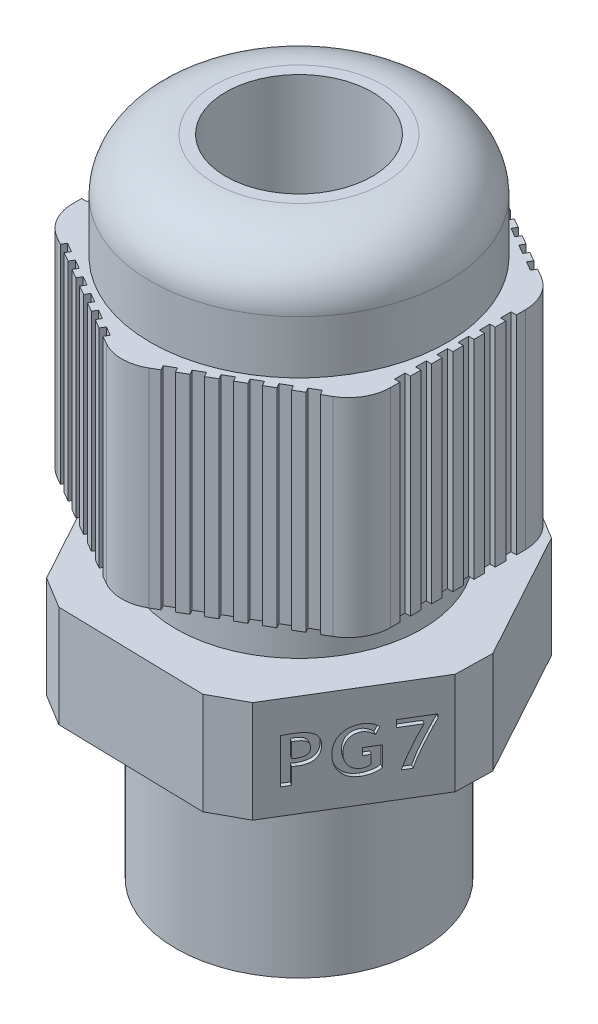
from build123d import *

# Parameters (mm, degrees)
SKETCH1_R           = 5.8
BOSS_EXTRUDE1_DEPTH = 8.25
BOSS_EXTRUDE2_DEPTH = 4.8
SKETCH3_R           = 5.8
BOSS_EXTRUDE3_DEPTH = 2.5
BOSS_EXTRUDE4_DEPTH = 9.8
CHAMFER1_SIZE       = 1
FILLET1_R           = 2
SKETCH5_R           = 7
BOSS_EXTRUDE5_DEPTH = 5
FILLET2_SIZE        = 2.5
FILLET2_SIZE_2      = 3
SKETCH6_R           = 3.45
CUT_EXTRUDE1_DEPTH  = 30.35
CUT_EXTRUDE2_DEPTH  = 0.2
SKETCH8_W           = 0.5
SKETCH8_H           = 9.8
CUT_EXTRUDE3_DEPTH  = 0.25
CIRPATTERN1_COUNT   = 6
CIRPATTERN2_COUNT   = 3


with BuildPart() as part:
    # Sketch1 → Boss-Extrude1 (new body)
    with BuildSketch(Plane(origin=(0, 0, 0), x_dir=(1, 0, 0), z_dir=(0, 1, 0))):
        with Locations(Location((0, 0, 0), (0, 0, 270))):
            Circle(SKETCH1_R)
    extrude(amount=BOSS_EXTRUDE1_DEPTH)

    # Sketch2 → Boss-Extrude2 (add)
    with BuildSketch(Plane(origin=(0, 8.25, 0), x_dir=(1, 0, 0), z_dir=(0, 1, 0))):
        Polygon((8.946496097, -0.208664632), (4.65395692, 7.643560578), (-4.292539176, 7.85222521), (-8.946496097, 0.208664632), (-4.65395692, -7.643560578), (4.292539176, -7.85222521), align=None)
    extrude(amount=BOSS_EXTRUDE2_DEPTH)

    # Sketch3 → Boss-Extrude3 (add)
    with BuildSketch(Plane(origin=(0, 13.05, 0), x_dir=(1, 0, 0), z_dir=(0, 1, 0))):
        with Locations(Location((0, 0, 0), (0, 0, 270))):
            Circle(SKETCH3_R)
    extrude(amount=BOSS_EXTRUDE3_DEPTH)

    # Sketch4 → Boss-Extrude4 (add)
    with BuildSketch(Plane(origin=(0, 15.55, 0), x_dir=(1, 0, 0), z_dir=(0, 1, 0))):
        Polygon((7.5, 4.330127019), (0, 8.660254038), (-7.5, 4.330127019), (-7.5, -4.330127019), (0, -8.660254038), (7.5, -4.330127019), align=None)
    extrude(amount=BOSS_EXTRUDE4_DEPTH)

    # Chamfer1
    chamfer1_edges = [part.edges().sort_by_distance(p)[0] for p in [
        (4.292539176, 10.65, 7.85222521),
        (8.946496097, 10.65, 0.208664632),
        (4.65395692, 10.65, -7.643560578),
        (-4.292539176, 10.65, -7.85222521),
        (-8.946496097, 10.65, -0.208664632),
        (-4.65395692, 10.65, 7.643560578),
    ]]
    chamfer(chamfer1_edges, length=CHAMFER1_SIZE)

    # Fillet1
    fillet1_edges = [part.edges().sort_by_distance(p)[0] for p in [
        (7.5, 20.45, 4.330127019),
        (7.5, 20.45, -4.330127019),
        (0, 20.45, -8.660254038),
        (-7.5, 20.45, -4.330127019),
        (-7.5, 20.45, 4.330127019),
        (0, 20.45, 8.660254038),
    ]]
    fillet(fillet1_edges, radius=FILLET1_R)

    # Sketch5 → Boss-Extrude5 (add)
    with BuildSketch(Plane(origin=(0, 25.35, 0), x_dir=(1, 0, 0), z_dir=(0, 1, 0))):
        with Locations(Location((0, 0, 0), (0, 0, 270))):
            Circle(SKETCH5_R)
    extrude(amount=BOSS_EXTRUDE5_DEPTH)

    # Fillet2
    # a fillet whose section is not a circle: 3, 2.5 mm, written as the material it takes off along each edge
    with BuildSketch(Plane(origin=(0, 30.35, 0), x_dir=(0, 0, 1), z_dir=(-1, 0, 0))) as fillet2_piece_1:
        with BuildLine():
            Bezier((7, -FILLET2_SIZE), (7, 0), (7 - FILLET2_SIZE_2, 0), weights=[1, 0.707106781, 1])
            Line((7 - FILLET2_SIZE_2, 0), (7, 0))
            Line((7, 0), (7, -FILLET2_SIZE))
        make_face()
    revolve(axis=Axis((0, 30.35, 0), (0, 1, 0)), mode=Mode.SUBTRACT)

    # Sketch6 → Cut-Extrude1 (cut)
    with BuildSketch(Plane(origin=(0, 30.35, 0), x_dir=(1, 0, 0), z_dir=(0, 1, 0))):
        with Locations(Location((0, 0, 0), (0, 0, 270))):
            Circle(SKETCH6_R)
    extrude(amount=-CUT_EXTRUDE1_DEPTH, mode=Mode.SUBTRACT)

    # Sketch7 → Cut-Extrude2 (cut)
    # profile 1 of 3: a face of its own
    with BuildSketch(Plane(origin=(-6.800226508, 0, 3.717447973), x_dir=(0.4796707062222577, 0, 0.8774485817369816), z_dir=(-0.8774485817369816, 0, 0.4796707062222577))):
        with BuildLine():
            Line((-2.134885405, 10.216379947), (-2.134885405, 9.45))
            Line((-2.134885405, 9.45), (-2.513219528, 9.45))
            Line((-2.513219528, 9.45), (-2.513219528, 11.542238367))
            add(Edge.make_bspline(
                [(-2.513219528, 11.542238367), (-2.483523913, 11.543567356), (-2.427375364, 11.546080213), (-2.347967637, 11.548688603), (-2.27846118, 11.551957657), (-2.218632578, 11.553974035), (-2.168665192, 11.555578539), (-2.128279385, 11.557149828), (-2.097725351, 11.557314508), (-2.08055587, 11.55770478), (-2.073659459, 11.55786154)],
                knots=[0, 0, 0, 0, 1.621915894, 3.06672294, 4.33503342, 5.418568965, 6.332983946, 7.062930741, 7.623610357, 8, 8, 8, 8], degree=3))
            add(Edge.make_bspline(
                [(-2.073659459, 11.55786154), (-2.033253135, 11.557378437), (-1.95518837, 11.556445087), (-1.842316581, 11.549232733), (-1.737858336, 11.537617628), (-1.641731769, 11.521448641), (-1.553863318, 11.500074815), (-1.474521723, 11.473564124), (-1.403211823, 11.442992506), (-1.340418447, 11.406840154), (-1.285417521, 11.365570046), (-1.237401277, 11.319382527), (-1.197617084, 11.26710511), (-1.163991949, 11.210101824), (-1.138970637, 11.147036902), (-1.12063961, 11.078922791), (-1.110248523, 11.005456847), (-1.108749639, 10.954782697), (-1.107978502, 10.928712162)],
                knots=[0, 0, 0, 0, 1.477239666, 2.854017795, 4.133233606, 5.318502461, 6.415589596, 7.435923392, 8.373832858, 9.247662204, 10.078235651, 10.882486382, 11.675045235, 12.472932273, 13.294755343, 14.147339862, 15.04685446, 16, 16, 16, 16], degree=3))
            add(Edge.make_bspline(
                [(-1.107978502, 10.928712162), (-1.108573533, 10.899542636), (-1.109730059, 10.842847635), (-1.120185701, 10.760787184), (-1.13618153, 10.684080634), (-1.160129653, 10.61328312), (-1.189904379, 10.547710765), (-1.227062562, 10.488065605), (-1.270707731, 10.4339653), (-1.321709039, 10.385985109), (-1.378896899, 10.343043645), (-1.443115023, 10.306352429), (-1.513823244, 10.275484008), (-1.591060478, 10.250283457), (-1.674939167, 10.230432462), (-1.765622391, 10.216886085), (-1.86293348, 10.208306115), (-1.930076108, 10.207225702), (-1.9647195, 10.206668245)],
                knots=[0, 0, 0, 0, 1.091067431, 2.120640177, 3.090684274, 4.018396006, 4.911555342, 5.779703764, 6.64093865, 7.505260178, 8.393264397, 9.311130961, 10.266246865, 11.27557445, 12.347403441, 13.487847833, 14.703811947, 16, 16, 16, 16], degree=3))
            add(Edge.make_bspline(
                [(-1.9647195, 10.206668245), (-1.976123556, 10.206701924), (-2.000920231, 10.206775155), (-2.040735846, 10.209336139), (-2.086082113, 10.21207232), (-2.118001293, 10.214889669), (-2.134885405, 10.216379947)],
                knots=[0, 0, 0, 0, 0.802473668, 1.744877334, 2.807120216, 4, 4, 4, 4], degree=3))
        make_face()
        with BuildLine():
            Line((-2.134885405, 11.226396934), (-2.134885405, 10.541088585))
            add(Edge.make_bspline(
                [(-2.134885405, 10.541088585), (-2.119684957, 10.539683417), (-2.091123571, 10.53704313), (-2.050769504, 10.53327857), (-2.015540106, 10.531766425), (-1.993714297, 10.531209597), (-1.983720656, 10.530954636)],
                knots=[0, 0, 0, 0, 1.208754047, 2.271228472, 3.208426916, 4, 4, 4, 4], degree=3))
            add(Edge.make_bspline(
                [(-1.983720656, 10.530954636), (-1.962880278, 10.531135836), (-1.922560705, 10.531486401), (-1.864374221, 10.535910165), (-1.810433828, 10.542296714), (-1.761048697, 10.552316235), (-1.715568643, 10.563521662), (-1.674842164, 10.578994779), (-1.638315092, 10.596684303), (-1.605589771, 10.616857511), (-1.577622667, 10.641052235), (-1.552489017, 10.66758982), (-1.53250897, 10.698541535), (-1.51519604, 10.732191227), (-1.50224623, 10.769609665), (-1.493254671, 10.810290418), (-1.486924704, 10.854201041), (-1.486521703, 10.884633205), (-1.486312624, 10.900421552)],
                knots=[0, 0, 0, 0, 1.403595211, 2.715515055, 3.929222961, 5.059826169, 6.108541088, 7.08069188, 7.988175292, 8.840483437, 9.661193659, 10.47314836, 11.293639464, 12.13324769, 13.017905562, 13.951754922, 14.937360934, 16, 16, 16, 16], degree=3))
            add(Edge.make_bspline(
                [(-1.486312624, 10.900421552), (-1.48667261, 10.913965119), (-1.487370582, 10.940224546), (-1.494066128, 10.978134579), (-1.503859402, 11.013686705), (-1.519019714, 11.04628161), (-1.537603358, 11.076815354), (-1.561032375, 11.104213439), (-1.588583551, 11.128943766), (-1.619855059, 11.151475598), (-1.655744825, 11.170803974), (-1.695521578, 11.187589522), (-1.739433227, 11.201996391), (-1.787421917, 11.213745397), (-1.83983467, 11.222321087), (-1.896158474, 11.229216183), (-1.956789048, 11.23286888), (-1.99849506, 11.23333462), (-2.020033975, 11.233575149)],
                knots=[0, 0, 0, 0, 0.913750955, 1.771658647, 2.592923553, 3.396899075, 4.190866566, 5.000218413, 5.821208234, 6.686404457, 7.596737657, 8.567773798, 9.598787233, 10.714604217, 11.900680618, 13.183445848, 14.545401084, 16, 16, 16, 16], degree=3))
            add(Edge.make_bspline(
                [(-2.020033975, 11.233575149), (-2.0394783, 11.233344616), (-2.077884026, 11.232889277), (-2.116044894, 11.228542831), (-2.134885405, 11.226396934)],
                knots=[0, 0, 0, 0, 1.012574262, 2, 2, 2, 2], degree=3))
        make_face(mode=Mode.SUBTRACT)
    # profile 2 of 3: a face of its own
    with BuildSketch(Plane(origin=(-6.800226508, 0, 3.717447973), x_dir=(0.4796707062222577, 0, 0.8774485817369816), z_dir=(-0.8774485817369816, 0, 0.4796707062222577))):
        with BuildLine():
            Line((0.891787574, 11.341670612), (0.736400346, 11.043563592))
            add(Edge.make_bspline(
                [(0.736400346, 11.043563592), (0.724076867, 11.054375595), (0.697509418, 11.077684544), (0.650376761, 11.109333555), (0.594070525, 11.140270196), (0.53178361, 11.170870113), (0.467487444, 11.198270759), (0.405340879, 11.218223881), (0.348040675, 11.23111622), (0.311253795, 11.232786508), (0.293884542, 11.233575149)],
                knots=[0, 0, 0, 0, 0.803088321, 1.731330006, 2.775510355, 3.951250131, 5.13276654, 6.197670446, 7.149014066, 8, 8, 8, 8], degree=3))
            add(Edge.make_bspline(
                [(0.293884542, 11.233575149), (0.268516955, 11.232929848), (0.218996656, 11.23167015), (0.146871851, 11.221756719), (0.078924726, 11.205833067), (0.014985708, 11.183361622), (-0.044924973, 11.154189176), (-0.100354598, 11.117950684), (-0.152063557, 11.075802101), (-0.1990169, 11.027314535), (-0.241340233, 10.973562986), (-0.278332239, 10.915067323), (-0.30893569, 10.851866097), (-0.334584632, 10.784528593), (-0.354272188, 10.712832218), (-0.368057371, 10.636664225), (-0.376661638, 10.556205217), (-0.377767163, 10.500997323), (-0.378334122, 10.472684425)],
                knots=[0, 0, 0, 0, 1.061607425, 2.072373566, 3.041316938, 3.978664007, 4.903577062, 5.82367322, 6.744825227, 7.690652244, 8.643063079, 9.60425442, 10.581865327, 11.577666068, 12.616882387, 13.689323984, 14.814989508, 16, 16, 16, 16], degree=3))
            add(Edge.make_bspline(
                [(-0.378334122, 10.472684425), (-0.377962667, 10.445773892), (-0.377239168, 10.393359162), (-0.368277431, 10.31690348), (-0.355159316, 10.244511191), (-0.33600237, 10.176132357), (-0.311761697, 10.111780412), (-0.281329353, 10.051903583), (-0.246408437, 9.995639321), (-0.205324345, 9.94434383), (-0.159961614, 9.897847329), (-0.110255241, 9.857421608), (-0.056507594, 9.82335115), (0.001011436, 9.795469319), (0.062633939, 9.773731709), (0.128022503, 9.758317236), (0.197469442, 9.748738382), (0.24501259, 9.747762822), (0.269394163, 9.747262525)],
                knots=[0, 0, 0, 0, 1.175642092, 2.289845553, 3.36012681, 4.388586818, 5.389480953, 6.360704106, 7.319987344, 8.278875946, 9.227266791, 10.15446886, 11.072687671, 12.002702105, 12.942533815, 13.922910871, 14.934805516, 16, 16, 16, 16], degree=3))
            add(Edge.make_bspline(
                [(0.269394163, 9.747262525), (0.285453965, 9.747571972), (0.316952465, 9.748178899), (0.363116766, 9.75338429), (0.407218275, 9.761695109), (0.44906008, 9.773728909), (0.489088613, 9.788116013), (0.526275913, 9.807312362), (0.562208552, 9.828328595), (0.583747872, 9.845781133), (0.59452505, 9.854513493)],
                knots=[0, 0, 0, 0, 1.102277998, 2.161926074, 3.18530887, 4.179487772, 5.148746423, 6.099475529, 7.049074482, 8, 8, 8, 8], degree=3))
            Line((0.59452505, 9.854513493), (0.59452505, 10.260715977))
            Line((0.59452505, 10.260715977), (0.297262525, 10.260715977))
            Line((0.297262525, 10.260715977), (0.297262525, 10.585002367))
            Line((0.297262525, 10.585002367), (0.972859172, 10.585002367))
            Line((0.972859172, 10.585002367), (0.972859172, 9.651834498))
            add(Edge.make_bspline(
                [(0.972859172, 9.651834498), (0.949599291, 9.634226486), (0.901743675, 9.597999204), (0.82024986, 9.553364669), (0.729631307, 9.514513393), (0.631328024, 9.482030262), (0.528658008, 9.455498456), (0.42456813, 9.437256854), (0.320771845, 9.425142485), (0.251552376, 9.423696959), (0.217035423, 9.422976134)],
                knots=[0, 0, 0, 0, 0.870664705, 1.79133311, 2.767049987, 3.813635233, 4.88153103, 5.932458395, 6.969000538, 8, 8, 8, 8], degree=3))
            add(Edge.make_bspline(
                [(0.217035423, 9.422976134), (0.180537752, 9.423851812), (0.109392973, 9.425558768), (0.00544294, 9.439351085), (-0.09262477, 9.461929835), (-0.185113491, 9.493775994), (-0.271730421, 9.534656426), (-0.352071975, 9.585706065), (-0.427185267, 9.644742349), (-0.495465696, 9.713105553), (-0.557075086, 9.788378839), (-0.610437262, 9.870485274), (-0.655973851, 9.958225017), (-0.692353632, 10.052129016), (-0.722079541, 10.151385747), (-0.741676485, 10.256857234), (-0.754330965, 10.367939725), (-0.755877139, 10.443935067), (-0.756668245, 10.482818375)],
                knots=[0, 0, 0, 0, 1.078523268, 2.102361525, 3.093383046, 4.048598645, 4.988386713, 5.917589169, 6.856492748, 7.806721191, 8.767744943, 9.72667712, 10.696138106, 11.684273533, 12.699256925, 13.754277165, 14.850967335, 16, 16, 16, 16], degree=3))
            add(Edge.make_bspline(
                [(-0.756668245, 10.482818375), (-0.755785722, 10.521706102), (-0.754056713, 10.597893563), (-0.740225399, 10.709366005), (-0.718065346, 10.815265476), (-0.686809667, 10.915651344), (-0.646045848, 11.010246675), (-0.596395164, 11.099377003), (-0.537945532, 11.183092316), (-0.470291249, 11.260116192), (-0.395492528, 11.330066869), (-0.314036735, 11.391494201), (-0.225792216, 11.442647028), (-0.131717204, 11.485303516), (-0.030986256, 11.517462249), (0.075500997, 11.541306755), (0.188370696, 11.555317669), (0.265695409, 11.557000129), (0.305285235, 11.55786154)],
                knots=[0, 0, 0, 0, 1.09580876, 2.146869803, 3.160705443, 4.141905076, 5.105078571, 6.058760661, 7.012970696, 7.977319969, 8.942900637, 9.895021932, 10.846233649, 11.812172839, 12.800771104, 13.821013303, 14.884370835, 16, 16, 16, 16], degree=3))
            add(Edge.make_bspline(
                [(0.305285235, 11.55786154), (0.333466334, 11.557231877), (0.389029752, 11.555990401), (0.470702702, 11.545589003), (0.549173164, 11.528822356), (0.624359871, 11.504992235), (0.696408779, 11.474611005), (0.765112009, 11.437047884), (0.831028972, 11.393326838), (0.871423711, 11.358983721), (0.891787574, 11.341670612)],
                knots=[0, 0, 0, 0, 1.05697557, 2.0839917, 3.08348732, 4.063827804, 5.038734547, 6.012267375, 6.997940923, 8, 8, 8, 8], degree=3))
        make_face()
    # profile 3 of 3: a face of its own
    with BuildSketch(Plane(origin=(-6.800226508, 0, 3.717447973), x_dir=(0.4796707062222577, 0, 0.8774485817369816), z_dir=(-0.8774485817369816, 0, 0.4796707062222577))):
        with BuildLine():
            Line((2.026789942, 9.45), (1.621431953, 9.45))
            add(Edge.make_bspline(
                [(1.621431953, 9.45), (1.631360844, 9.480282312), (1.65153799, 9.541820972), (1.683529259, 9.635284466), (1.718698784, 9.731056194), (1.756403757, 9.829344176), (1.795901128, 9.930459866), (1.838724889, 10.033793693), (1.883876724, 10.139797153), (1.931626534, 10.248307368), (1.981878847, 10.359363723), (2.034716889, 10.472927695), (2.089924766, 10.589173193), (2.148396997, 10.707594294), (2.208690896, 10.828895344), (2.271562202, 10.952716252), (2.337556848, 11.078762412), (2.382434195, 11.163638271), (2.405124064, 11.206551283)],
                knots=[0, 0, 0, 0, 0.794260991, 1.61406953, 2.461925064, 3.33686576, 4.23777069, 5.167373618, 6.124525522, 7.109355414, 8.121981726, 9.162513398, 10.231050836, 11.329228568, 12.454048731, 13.607132615, 14.79017254, 16, 16, 16, 16], degree=3))
            Line((2.405124064, 11.206551283), (1.459288758, 11.206551283))
            Line((1.459288758, 11.206551283), (1.459288758, 11.530837674))
            Line((1.459288758, 11.530837674), (2.89155365, 11.530837674))
            Line((2.89155365, 11.530837674), (2.89155365, 11.373761453))
            Line((2.89155365, 11.373761453), (2.705764572, 11.021606701))
            add(Edge.make_bspline(
                [(2.705764572, 11.021606701), (2.690239491, 10.991226529), (2.658530957, 10.929177851), (2.610881434, 10.833923831), (2.562290351, 10.734289605), (2.495180097, 10.595899752), (2.411728897, 10.418277354), (2.331492889, 10.238637866), (2.269561135, 10.095666396), (2.225565743, 9.991880872), (2.184534054, 9.891402365), (2.146873492, 9.794568837), (2.11137206, 9.702215557), (2.080584719, 9.613969468), (2.051786413, 9.530709166), (2.034955596, 9.476365447), (2.026789942, 9.45)],
                knots=[0, 0, 0, 0, 0.836079797, 1.707615262, 2.610034499, 3.552607617, 5.476750089, 7.419053175, 8.373784903, 9.29500588, 10.181483737, 11.033379653, 11.841190972, 12.605931847, 13.323652654, 14, 14, 14, 14], degree=3))
        make_face()
    cut_extrude2 = extrude(amount=-CUT_EXTRUDE2_DEPTH, mode=Mode.SUBTRACT)

    # Sketch8 → Cut-Extrude3 (cut)
    with BuildSketch(Plane(origin=(7.5, 0, 0), x_dir=(0, 0, -1), z_dir=(1, 0, 0))):
        with Locations((0.5, 20.45)):
            Rectangle(SKETCH8_W, SKETCH8_H)
        with Locations((-0.5, 20.45)):
            Rectangle(SKETCH8_W, SKETCH8_H)
        with Locations((1.5, 20.45)):
            Rectangle(SKETCH8_W, SKETCH8_H)
        with Locations((2.5, 20.45)):
            Rectangle(SKETCH8_W, SKETCH8_H)
        with Locations((-1.5, 20.45)):
            Rectangle(SKETCH8_W, SKETCH8_H)
        with Locations((-2.5, 20.45)):
            Rectangle(SKETCH8_W, SKETCH8_H)
    cut_extrude3 = extrude(amount=-CUT_EXTRUDE3_DEPTH, mode=Mode.SUBTRACT)

    # CirPattern1: Cut-Extrude3 ×6 about axis
    cirpattern1_axis = Axis((0, 0, 0), (0, 1, 0))
    for i in range(1, CIRPATTERN1_COUNT):
        add(cut_extrude3.rotate(cirpattern1_axis, i * 360 / CIRPATTERN1_COUNT), mode=Mode.SUBTRACT)

    # CirPattern2: Cut-Extrude2 ×3 about axis
    cirpattern2_axis = Axis((0, 13.05, 0), (0, 1, 0))
    for i in range(1, CIRPATTERN2_COUNT):
        add(cut_extrude2.rotate(cirpattern2_axis, i * 360 / CIRPATTERN2_COUNT), mode=Mode.SUBTRACT)


solid = part.part
